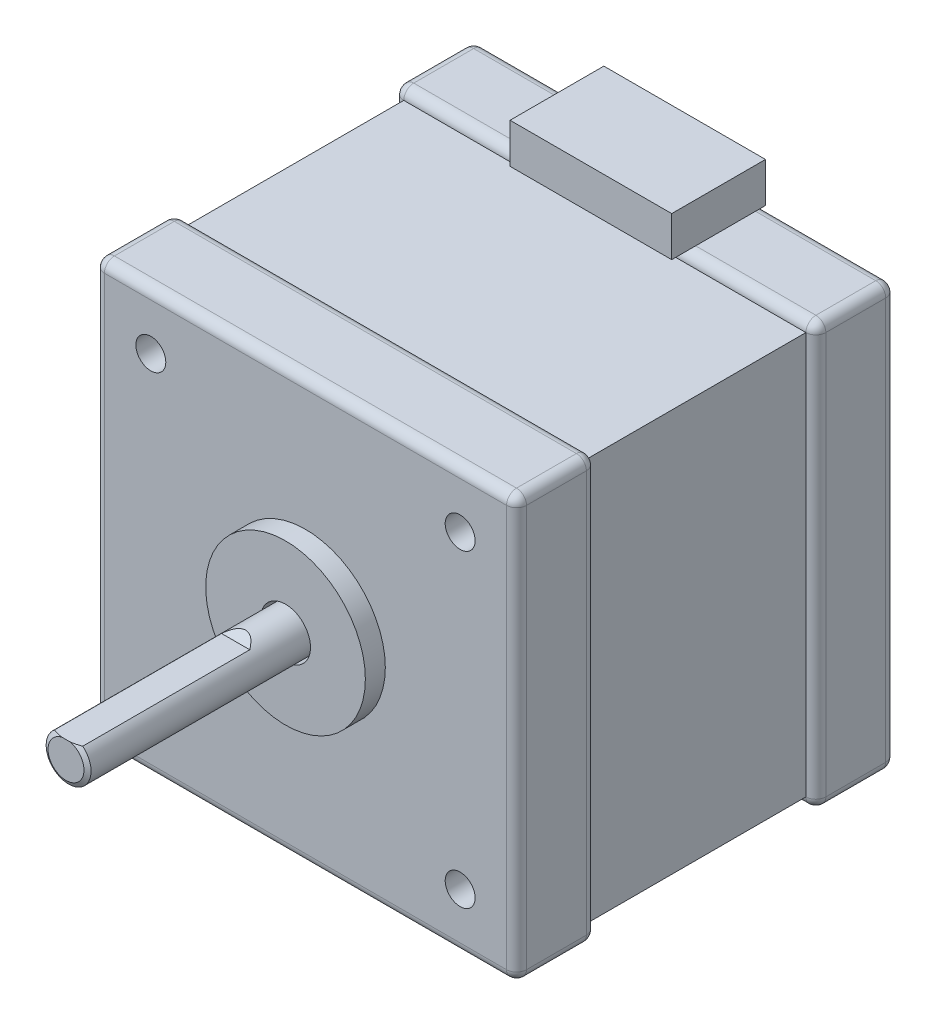
from build123d import *

# Parameters (mm, degrees)
SKETCH_1_W          = 42.3
SKETCH_1_H          = 42.3
EXTRUDE_1_DEPTH     = 38
SKETCH_3_R          = 1.5
CUT_EXTRUDE_1_DEPTH = 4.5
SKETCH_4_R          = 8
SKETCH_4_R_2        = 2.5
EXTRUDE_2_DEPTH     = 2
SKETCH_5_R          = 2.25
EXTRUDE_3_DEPTH     = 24
CUT_EXTRUDE_2_DEPTH = 24
FILLET_1_R          = 1
CUT_EXTRUDE_START   = -8
SKETCH_10_W         = 42.3
SKETCH_10_H         = 42.3
SKETCH_10_W_2       = 40.3
SKETCH_10_H_2       = 40.3
CUT_EXTRUDE_4_DEPTH = 22
FILLET_2_R          = 1
SKETCH_11_W         = 16.2
SKETCH_11_H         = 9.4
EXTRUDE_4_DEPTH     = 4


with BuildPart() as part:
    # 草图1 → 凸台-拉伸1 (new body)
    with BuildSketch(Plane.XY):
        with Locations((21.15, 21.15)):
            Rectangle(SKETCH_1_W, SKETCH_1_H)
    extrude(amount=EXTRUDE_1_DEPTH)

    # 草图3 → 切除-拉伸1 (cut)
    with BuildSketch(Plane.XY.offset(38)):
        with Locations((5.65, 36.65)):
            Circle(SKETCH_3_R)
        with Locations((36.65, 36.65)):
            Circle(SKETCH_3_R)
        with Locations(Location((36.65, 5.65, 0), (0, 0, 180))):
            Circle(SKETCH_3_R)
        with Locations(Location((5.65, 5.65, 0), (0, 0, 180))):
            Circle(SKETCH_3_R)
    extrude(amount=-CUT_EXTRUDE_1_DEPTH, mode=Mode.SUBTRACT)

    # 草图4 → 凸台-拉伸2 (add)
    with BuildSketch(Plane.XY.offset(38)):
        with Locations((21.15, 21.15)):
            Circle(SKETCH_4_R)
        with Locations((21.15, 21.15)):
            Circle(SKETCH_4_R_2, mode=Mode.SUBTRACT)
    extrude(amount=EXTRUDE_2_DEPTH)

    # 草图5 → 凸台-拉伸3 (add)
    with BuildSketch(Plane.XY.offset(38)):
        with Locations(Location((21.15, 21.15, 0), (0, 0, 180))):
            Circle(SKETCH_5_R)
    extrude(amount=EXTRUDE_3_DEPTH)

    # 草图6 → 切除-拉伸2 (cut)
    with BuildSketch(Plane(origin=(0, 0, 0), x_dir=(0, 0, -1), z_dir=(1, 0, 0))):
        Polygon((-62, 22.9), (-45, 22.9), (-44, 23.4), (-62, 23.4), align=None)
    extrude(amount=CUT_EXTRUDE_2_DEPTH, mode=Mode.SUBTRACT)

    # 草图9 → 切除-旋转1 (revolve, cut)
    with BuildSketch(Plane(origin=(0, 21.15, 0), x_dir=(1, 0, 0), z_dir=(0, 1, 0)), mode=Mode.PRIVATE) as cut_revolve_1_sk:
        Polygon((23.4, -61.739352103), (22.6, -62.201232319), (23.4, -62.201232319), align=None)
    revolve(cut_revolve_1_sk.sketch.rotate(Axis((21.15, 21.15, 62), (0, 0, -1)), 180), axis=Axis((21.15, 21.15, 62), (0, 0, -1)), mode=Mode.SUBTRACT)

    # 圆角1
    fillet_1_edges = [part.edges().sort_by_distance(p)[0] for p in [
        (42.3, 21.15, 38),
        (21.15, 42.3, 38),
        (0, 21.15, 38),
        (21.15, 42.3, 0),
        (42.3, 21.15, 0),
        (21.15, 0, 0),
        (0, 21.15, 0),
        (0, 42.3, 19),
        (42.3, 42.3, 19),
        (42.3, 0, 19),
        (0, 0, 19),
        (21.15, 0, 38),
    ]]
    fillet(fillet_1_edges, radius=FILLET_1_R)

    # 草图10 → 切除-拉伸4 (cut)
    with BuildSketch(Plane.XY.offset(38).offset(CUT_EXTRUDE_START)):
        with Locations((21.15, 21.15)):
            Rectangle(SKETCH_10_W, SKETCH_10_H)
        with Locations((21.15, 21.15)):
            Rectangle(SKETCH_10_W_2, SKETCH_10_H_2, mode=Mode.SUBTRACT)
    extrude(amount=-CUT_EXTRUDE_4_DEPTH, mode=Mode.SUBTRACT)

    # 圆角2
    fillet_2_edges = [part.edges().sort_by_distance(p)[0] for p in [
        (0.292893219, 0.292893219, 30),
        (0.292893219, 0.292893219, 8),
        (42.3, 21.15, 8),
        (21.15, 42.3, 8),
        (0, 21.15, 8),
        (21.15, 0, 8),
        (42.007106781, 42.007106781, 30),
        (42.007106781, 0.292893219, 30),
        (0.292893219, 42.007106781, 30),
        (42.007106781, 42.007106781, 8),
        (42.007106781, 0.292893219, 8),
        (0.292893219, 42.007106781, 8),
        (21.15, 42.3, 30),
        (0, 21.15, 30),
        (21.15, 0, 30),
        (42.3, 21.15, 30),
    ]]
    fillet(fillet_2_edges, radius=FILLET_2_R - 0.0001)  # a hair under: the kernel refuses the full size

    # 草图11 → 凸台-拉伸4 (add)
    with BuildSketch(Plane(origin=(0, 42.3, 0), x_dir=(1, 0, 0), z_dir=(0, 1, 0))):
        with Locations((21.15, -4.7)):
            Rectangle(SKETCH_11_W, SKETCH_11_H)
    extrude(amount=EXTRUDE_4_DEPTH)


solid = part.part
